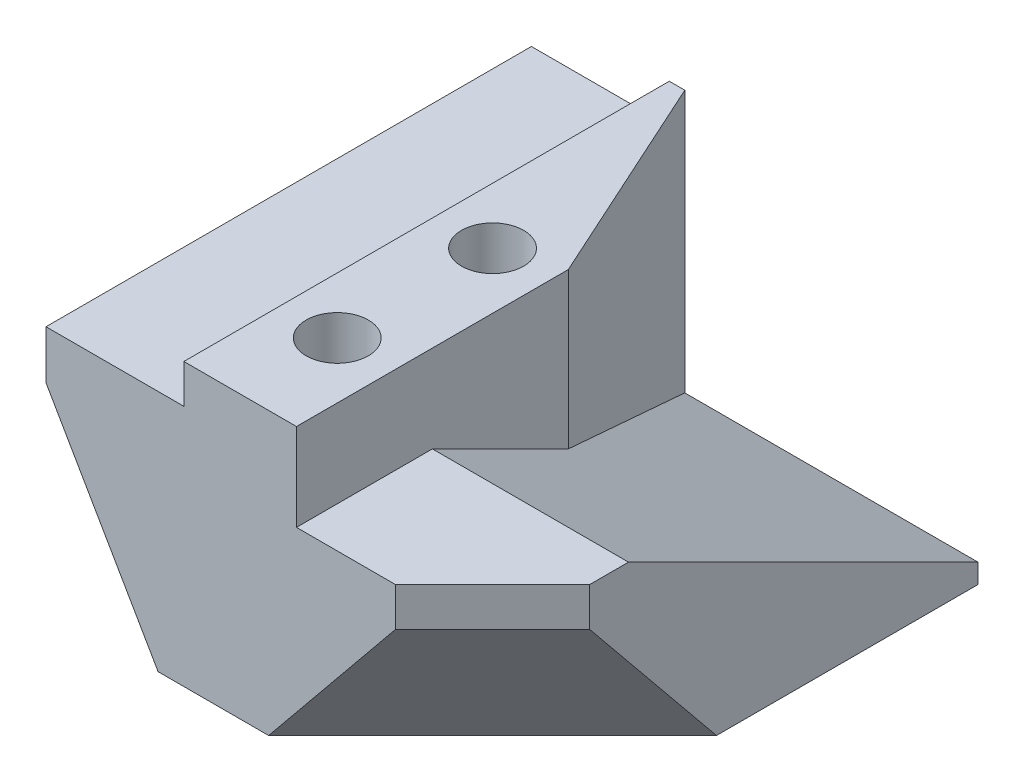
from build123d import *

# Parameters (mm, degrees)
SKETCH_1_W           = 20
SKETCH_1_H           = 20
EXTRUDE_1_DEPTH      = 4
SKETCH_2_W           = 12.9
SKETCH_2_H           = 20
EXTRUDE_2_DEPTH      = 4.5
SKETCH_3_R           = 1.6
CUT_EXTRUDE_1_DEPTH  = 30.533878851
SKETCH_4_W           = 5.8
SKETCH_4_H           = 20
SKETCH_4_R           = 1.6
EXTRUDE_3_DEPTH      = 2
SKETCH_5_R           = 3
CUT_EXTRUDE_3_DEPTH  = 2.4
SKETCH_6_W           = 20
SKETCH_6_H           = 4
EXTRUDE_4_DEPTH      = 3
EXTRUDE_START        = 4
SKETCH_7_W           = 23
SKETCH_7_H           = 20
SKETCH_7_R           = 3
EXTRUDE_5_DEPTH      = 4
SKETCH_9_W           = 10.1
SKETCH_9_H           = 20
EXTRUDE_6_DEPTH      = 2
EXTRUDE_7_DEPTH      = 5
CHAMFER_7_SIZE       = 10
CHAMFER_7_SIZE2      = 5.773502692
CHAMFER_8_SIZE       = 5
CHAMFER_9_SIZE       = 8
CHAMFER_9_SIZE2      = 4.618802154
CUT_EXTRUDE_9_DEPTH  = 10.1
CUT_EXTRUDE_10_REACH = 38.936
CHAMFER_10_SIZE      = 1.5


with BuildPart() as part:
    # 草图1 → 凸台-拉伸1 (new body)
    with BuildSketch(Plane(origin=(0, 0, 0), x_dir=(1, 0, 0), z_dir=(0, 1, 0))):
        with Locations((10, 10)):
            Rectangle(SKETCH_1_W, SKETCH_1_H)
    extrude(amount=EXTRUDE_1_DEPTH)

    # 草图2 → 凸台-拉伸2 (add)
    with BuildSketch(Plane(origin=(0, 4, 0), x_dir=(1, 0, 0), z_dir=(0, 1, 0))):
        with Locations((6.45, 10)):
            Rectangle(SKETCH_2_W, SKETCH_2_H)
    extrude(amount=EXTRUDE_2_DEPTH)

    # 草图3 → 切除-拉伸1 (cut, through all)
    with BuildSketch(Plane(origin=(0, 0, 0), x_dir=(-1, 0, 0), z_dir=(0, -1, 0))):
        with Locations(Location((-10, 5, 0), (0, 0, 90))):
            Circle(SKETCH_3_R)
        with Locations(Location((-10, 13, 0), (0, 0, 90))):
            Circle(SKETCH_3_R)
    extrude(amount=-CUT_EXTRUDE_1_DEPTH, mode=Mode.SUBTRACT)

    # 草图4 → 凸台-拉伸3 (add)
    with BuildSketch(Plane(origin=(0, 8.5, 0), x_dir=(1, 0, 0), z_dir=(0, 1, 0))):
        with Locations((10, 10)):
            Rectangle(SKETCH_4_W, SKETCH_4_H)
        with Locations(Location((10, 13, 0), (0, 0, 90))):
            Circle(SKETCH_4_R, mode=Mode.SUBTRACT)
        with Locations(Location((10, 5, 0), (0, 0, 90))):
            Circle(SKETCH_4_R, mode=Mode.SUBTRACT)
    extrude(amount=EXTRUDE_3_DEPTH)

    # 草图5 → 切除-拉伸3 (cut)
    with BuildSketch(Plane(origin=(0, 0, 0), x_dir=(-1, 0, 0), z_dir=(0, -1, 0))):
        with Locations(Location((-10, 5, 0), (0, 0, 90))):
            Circle(SKETCH_5_R)
        with Locations(Location((-10, 13, 0), (0, 0, 90))):
            Circle(SKETCH_5_R)
    extrude(amount=-CUT_EXTRUDE_3_DEPTH, mode=Mode.SUBTRACT)

    # 草图6 → 凸台-拉伸4 (add)
    with BuildSketch(Plane(origin=(20, 0, 0), x_dir=(0, 0, -1), z_dir=(1, 0, 0))):
        with Locations((10, 2)):
            Rectangle(SKETCH_6_W, SKETCH_6_H)
    extrude(amount=EXTRUDE_4_DEPTH)

    # 草图7 → 凸台-拉伸5 (add)
    with BuildSketch(Plane(origin=(0, 0, 0), x_dir=(-1, 0, 0), z_dir=(0, -1, 0)).offset(EXTRUDE_START)):
        with Locations((-11.5, 10)):
            Rectangle(SKETCH_7_W, SKETCH_7_H)
        with Locations(Location((-10, 13, 0), (0, 0, 90))):
            Circle(SKETCH_7_R, mode=Mode.SUBTRACT)
        with Locations(Location((-10, 5, 0), (0, 0, 90))):
            Circle(SKETCH_7_R, mode=Mode.SUBTRACT)
    extrude(amount=-EXTRUDE_5_DEPTH)

    # 草图9 → 凸台-拉伸6 (add)
    with BuildSketch(Plane(origin=(0, 4, 0), x_dir=(1, 0, 0), z_dir=(0, 1, 0))):
        with Locations((17.95, 10)):
            Rectangle(SKETCH_9_W, SKETCH_9_H)
    extrude(amount=EXTRUDE_6_DEPTH)

    # 草图11 → 凸台-拉伸7 (add)
    with BuildSketch(Plane(origin=(0, 0, -20), x_dir=(-1, 0, 0), z_dir=(0, 0, -1))):
        Polygon((-23, 6), (-23, -4), (0, -4), (0, 8.5), (-7.1, 8.5), (-7.1, 10.5), (-12.9, 10.5), (-12.9, 6), align=None)
    extrude(amount=EXTRUDE_7_DEPTH)

    # 倒角7
    chamfer_7_edges = [part.edges().sort_by_distance(p)[0] for p in [
        (0, -4, -12.5),
    ]]
    chamfer_7_side = [part.faces().sort_by_distance(p)[0] for p in [
        (0, 2.25, -12.5),
    ]]
    chamfer(chamfer_7_edges, length=CHAMFER_7_SIZE, length2=CHAMFER_7_SIZE2, reference=chamfer_7_side[0])

    # 倒角8
    chamfer_8_edges = [part.edges().sort_by_distance(p)[0] for p in [
        (23, 1, 0),
    ]]
    chamfer(chamfer_8_edges, length=CHAMFER_8_SIZE)

    # 倒角9
    chamfer_9_edges = [part.edges().sort_by_distance(p)[0] for p in [
        (20.5, -4, -2.5),
    ]]
    chamfer_9_side = [part.faces().sort_by_distance(p)[0] for p in [
        (20.5, 1, -2.5),
    ]]
    chamfer(chamfer_9_edges, length=CHAMFER_9_SIZE, length2=CHAMFER_9_SIZE2, reference=chamfer_9_side[0])

    # 草图15 → 切除-拉伸9 (cut)
    with BuildSketch(Plane(origin=(23, 0, 0), x_dir=(0, 0, -1), z_dir=(1, 0, 0))):
        Polygon((25, -3), (25, 6), (7, 6), align=None)
    extrude(amount=-CUT_EXTRUDE_9_DEPTH, mode=Mode.SUBTRACT)

    # 切除-拉伸10: up to this plane
    cut_extrude_10_end = Plane(origin=(-7.224611797, 6, -7), z_dir=(0, -0.894427190999916, 0.447213595499958))
    # 草图16 → 切除-拉伸10 (cut, up to the surface)
    with BuildSketch(Plane(origin=(0, 10.5, 0), x_dir=(1, 0, 0), z_dir=(0, 1, 0)), mode=Mode.PRIVATE) as cut_extrude_10_sk1:
        Polygon((7.9, 25), (12.9, 25), (12.9, 14), align=None)
    cut_extrude_10_tool1 = split(extrude(cut_extrude_10_sk1.sketch, amount=-CUT_EXTRUDE_10_REACH, mode=Mode.PRIVATE), bisect_by=cut_extrude_10_end, keep=Keep.BOTH, mode=Mode.PRIVATE)
    add(cut_extrude_10_tool1.solids().sort_by_distance((11.233333, 10.5, -21.333333))[0], mode=Mode.SUBTRACT)

    # 倒角10
    # the kernel refuses this chamfer: 1.5 mm, written as the material it takes off along each edge
    with BuildSketch(Plane(origin=(10, 2.4, -13), x_dir=(0, 0, -1), z_dir=(-1, 0, 0))) as chamfer_10_piece_1_section:
        Polygon((1.6, -CHAMFER_10_SIZE), (1.6 + CHAMFER_10_SIZE, 0), (1.6, 0), align=None)
    chamfer_10_piece_1 = revolve(axis=Axis((10, 2.4, -13), (0, -1, 0)), mode=Mode.PRIVATE)
    chamfer_10_piece_1 = chamfer_10_piece_1 & Plane(origin=(10, 3.20338318, -13), x_dir=(0, 0, -1), z_dir=(0, -1, 0)) * Cylinder(3, 13, mode=Mode.PRIVATE)
    add(chamfer_10_piece_1, mode=Mode.SUBTRACT)
    with BuildSketch(Plane(origin=(10, 2.4, -5), x_dir=(0, 0, -1), z_dir=(-1, 0, 0))) as chamfer_10_piece_2_section:
        Polygon((1.6, -CHAMFER_10_SIZE), (1.6 + CHAMFER_10_SIZE, 0), (1.6, 0), align=None)
    chamfer_10_piece_2 = revolve(axis=Axis((10, 2.4, -5), (0, -1, 0)), mode=Mode.PRIVATE)
    chamfer_10_piece_2 = chamfer_10_piece_2 & Plane(origin=(10, 3.20338318, -5), x_dir=(0, 0, -1), z_dir=(0, -1, 0)) * Cylinder(3, 13, mode=Mode.PRIVATE)
    add(chamfer_10_piece_2, mode=Mode.SUBTRACT)


solid = part.part
